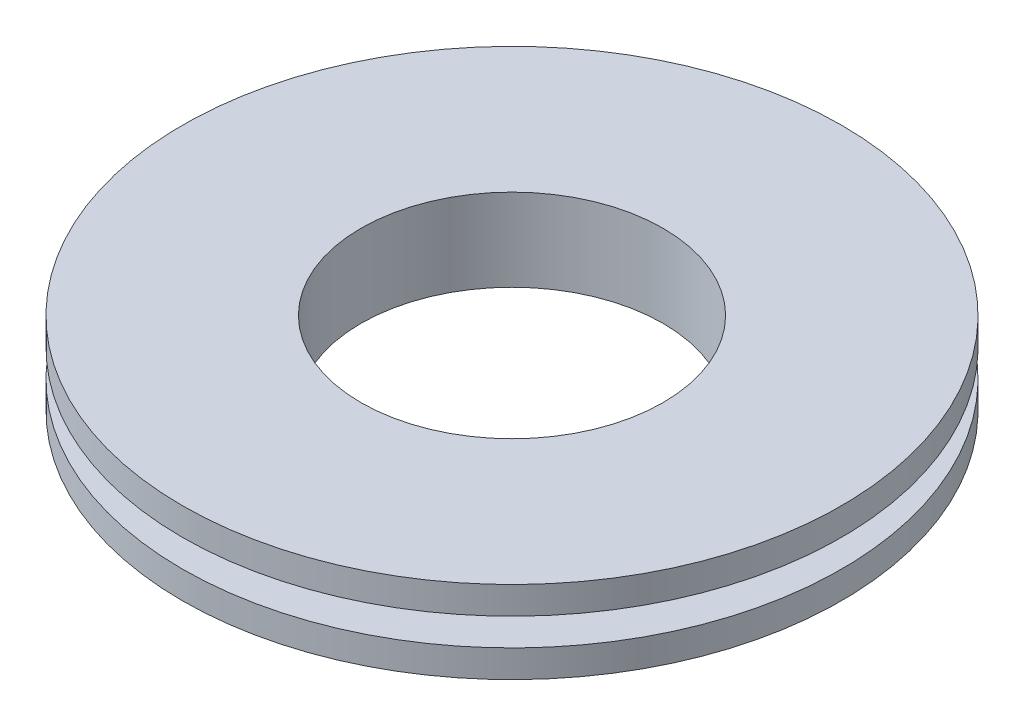
from build123d import *

# Parameters (mm, degrees)
SKETCH1_R           = 10
SKETCH1_R_2         = 5.5
BOSS_EXTRUDE1_DEPTH = 3
BOSS_EXTRUDE2_START = -1
SKETCH2_R           = 12
SKETCH2_R_2         = 10
BOSS_EXTRUDE2_DEPTH = 1
SKETCH3_R           = 12
SKETCH3_R_2         = 10
BOSS_EXTRUDE3_DEPTH = 1
FILLET2_R           = 0.5


with BuildPart() as part:
    # Sketch1 → Boss-Extrude1 (new body)
    with BuildSketch(Plane(origin=(0, 0, 0), x_dir=(1, 0, 0), z_dir=(0, 1, 0))):
        with Locations(Location((0, 0, 0), (0, 0, 270))):
            Circle(SKETCH1_R)
        with Locations(Location((0, 0, 0), (0, 0, 270))):
            Circle(SKETCH1_R_2, mode=Mode.SUBTRACT)
    extrude(amount=BOSS_EXTRUDE1_DEPTH)

    # Sketch2 → Boss-Extrude2 (add)
    with BuildSketch(Plane(origin=(0, 3, 0), x_dir=(1, 0, 0), z_dir=(0, 1, 0)).offset(BOSS_EXTRUDE2_START)):
        with Locations(Location((0, 0, 0), (0, 0, 270))):
            Circle(SKETCH2_R)
        with Locations(Location((0, 0, 0), (0, 0, 270))):
            Circle(SKETCH2_R_2, mode=Mode.SUBTRACT)
    extrude(amount=BOSS_EXTRUDE2_DEPTH)

    # Sketch3 → Boss-Extrude3 (add)
    with BuildSketch(Plane.XZ):
        with Locations(Location((0, 0, 0), (0, 0, 90))):
            Circle(SKETCH3_R)
        with Locations(Location((0, 0, 0), (0, 0, 270))):
            Circle(SKETCH3_R_2, mode=Mode.SUBTRACT)
    extrude(amount=-BOSS_EXTRUDE3_DEPTH)

    # Fillet2
    fillet2_edges = [part.edges().sort_by_distance(p)[0] for p in [
        (0, 2, -10),
        (0, 1, -10),
    ]]
    fillet(fillet2_edges, radius=FILLET2_R - 0.0001)  # a hair under: the kernel refuses the full size


solid = part.part
